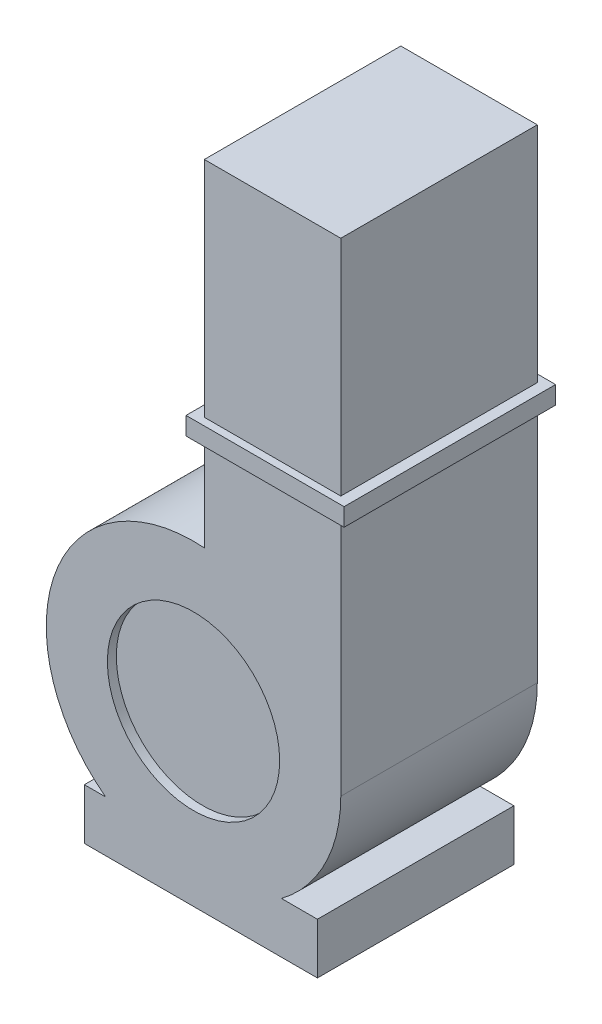
from build123d import *

# Parameters (mm, degrees)
BOSS_EXTRUDE1_DEPTH = 11
SKETCH2_R           = 9.644275983
CUT_EXTRUDE1_DEPTH  = 1
SHELL1_START        = -9
SHELL1_DEPTH        = 17
SHELL1_START_2      = 8
SHELL1_2_OUTLINE_R  = 11.644275983
SHELL1_2_DEPTH      = 1
BOSS_EXTRUDE2_REACH = 39.16
SKETCH3_W           = 26.092999246
SKETCH3_H           = 5.699260362
SKETCH4_W           = 17.696218594
SKETCH4_H           = 23.681228884
SKETCH4_W_2         = 15.279066264
SKETCH4_H_2         = 22
BOSS_EXTRUDE3_DEPTH = 2
SKETCH5_W           = 15.279066264
SKETCH5_H           = 22
BOSS_EXTRUDE4_DEPTH = 25


# Read off the part's stored shape, not the designer's step: Shell1
with BuildPart() as part:
    # Sketch1 → Boss-Extrude1 (new, symmetric)
    with BuildSketch(Plane.XY):
        with BuildLine():
            Line((1.208576165, 18.591616866), (1.208576165, 7.930929707))
            ThreePointArc((1.208576165, 7.930929707), (-12.078264042, -19.735453873), (16.487642429, -8.512357571))
            Line((16.487642429, -8.512357571), (16.487642429, 18.591616866))
            Line((16.487642429, 18.591616866), (1.208576165, 18.591616866))
        make_face()
    extrude(amount=BOSS_EXTRUDE1_DEPTH, both=True)

    # Sketch2 → Cut-Extrude1 (cut)
    with BuildSketch(Plane.XY.offset(11)):
        with Locations((0, -8.512357571)):
            Circle(SKETCH2_R)
    extrude(amount=-CUT_EXTRUDE1_DEPTH, mode=Mode.SUBTRACT)

    # Shell1 outline → Shell1 (cut)
    with BuildSketch(Plane.XY.offset(SHELL1_START)):
        with BuildLine():
            Line((3.208576165, 18.591616866), (3.208576165, 5.615516371))
            ThreePointArc((3.208576165, 5.615516371), (-11.322024715, -17.551358594), (14.487642429, -8.512357571))
            Line((14.487642429, -8.512357571), (14.487642429, 18.591616866))
            Line((14.487642429, 18.591616866), (3.208576165, 18.591616866))
        make_face()
    extrude(amount=SHELL1_DEPTH, mode=Mode.SUBTRACT)

    # Shell1 2 outline → Shell1 2 (cut)
    with BuildSketch(Plane.XY.offset(SHELL1_START_2)):
        with BuildLine():
            Line((3.208576165, 18.591616866), (3.208576165, 5.615516371))
            ThreePointArc((3.208576165, 5.615516371), (-11.322024715, -17.551358594), (14.487642429, -8.512357571))
            Line((14.487642429, -8.512357571), (14.487642429, 18.591616866))
            Line((14.487642429, 18.591616866), (3.208576165, 18.591616866))
        make_face()
        with Locations((0, -8.512357571)):
            Circle(SHELL1_2_OUTLINE_R, mode=Mode.SUBTRACT)
    extrude(amount=SHELL1_2_DEPTH, mode=Mode.SUBTRACT)

    # Boss-Extrude2: up to this face of the body (flat: up to its plane)
    boss_extrude2_end = Plane(part.part.faces().sort_by_distance((2.030831777, -4.5272693, -11))[0])
    # Sketch3 → Boss-Extrude2 (add, up to the picked face)
    with BuildSketch(Plane.XY.offset(11), mode=Mode.PRIVATE) as boss_extrude2_sk1:
        with Locations((0.82398945, -24.59358437)):
            Rectangle(SKETCH3_W, SKETCH3_H)
    boss_extrude2_tool1 = split(extrude(boss_extrude2_sk1.sketch, amount=-BOSS_EXTRUDE2_REACH, mode=Mode.PRIVATE), bisect_by=boss_extrude2_end, keep=Keep.BOTH, mode=Mode.PRIVATE)
    add(boss_extrude2_tool1.solids().sort_by(Axis((0.823989, -24.593584, 11), (0, 0, -1)))[0])


with BuildPart() as body_2:
    # Sketch4 → Boss-Extrude3 (new body)
    with BuildSketch(Plane(origin=(0, 18.591616866, 0), x_dir=(1, 0, 0), z_dir=(0, 1, 0))):
        with Locations((8.848109297, 0)):
            Rectangle(SKETCH4_W, SKETCH4_H)
        with Locations((8.848109297, 0)):
            Rectangle(SKETCH4_W_2, SKETCH4_H_2, mode=Mode.SUBTRACT)
    extrude(amount=BOSS_EXTRUDE3_DEPTH)


with BuildPart() as body_3:
    # Sketch5 → Boss-Extrude4 (new body)
    with BuildSketch(Plane(origin=(0, 20.591616866, 0), x_dir=(1, 0, 0), z_dir=(0, 1, 0))):
        with Locations((8.848109297, 0)):
            Rectangle(SKETCH5_W, SKETCH5_H)
    extrude(amount=BOSS_EXTRUDE4_DEPTH)


solid = Compound([part.part, body_2.part, body_3.part])
